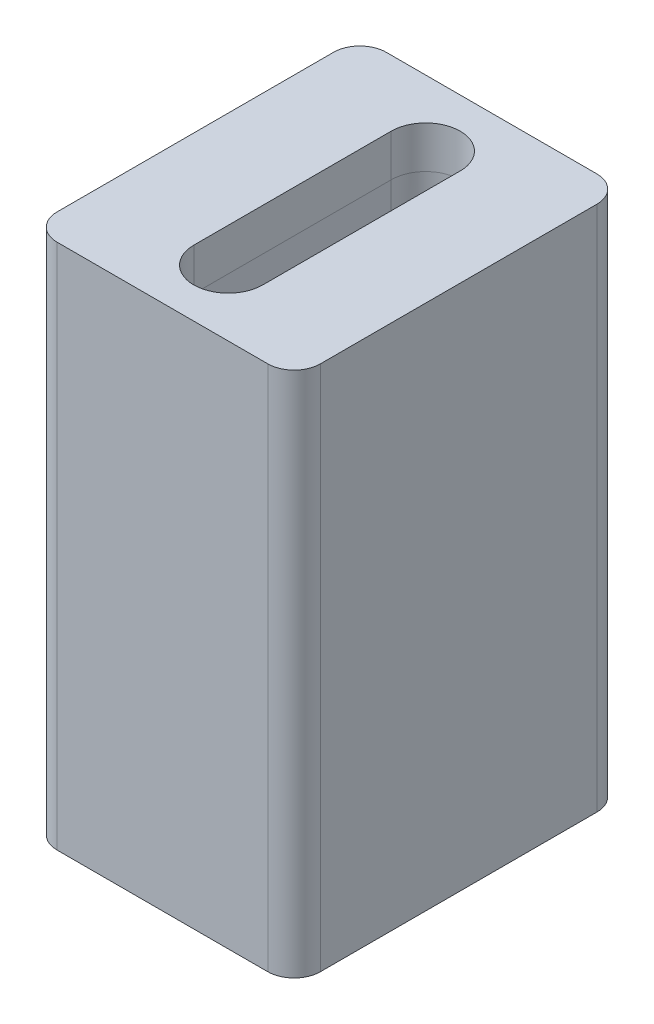
from build123d import *

# Parameters (mm, degrees)
BOSS_EXTRUDE1_DEPTH         = 40
CUT_EXTRUDE2_REACH          = 45.084
M3_TAPPED_HOLE1_D           = 2.5
M3_TAPPED_HOLE1_DEPTH       = 8.5
M3_TAPPED_HOLE1_CSINK_D     = 3.05
M3_TAPPED_HOLE1_CSINK_ANGLE = 90
M3_TAPPED_HOLE1_TIP         = 0.751075774


with BuildPart() as part:
    # Sketch1 → Boss-Extrude1 (new body)
    with BuildSketch(Plane(origin=(0, 0, 0), x_dir=(1, 0, 0), z_dir=(0, 1, 0))):
        with BuildLine():
            Line((-8, -12.5), (8, -12.5))
            ThreePointArc((8, -12.5), (9.414213562, -11.914213562), (10, -10.5))
            Line((10, -10.5), (10, 10.5))
            ThreePointArc((10, 10.5), (9.414213562, 11.914213562), (8, 12.5))
            Line((8, 12.5), (-8, 12.5))
            ThreePointArc((-8, 12.5), (-9.414213562, 11.914213562), (-10, 10.5))
            Line((-10, 10.5), (-10, -10.5))
            ThreePointArc((-10, -10.5), (-9.414213562, -11.914213562), (-8, -12.5))
        make_face()
    extrude(amount=-BOSS_EXTRUDE1_DEPTH)

    # Sketch5 → Cut-Extrude2 (cut, up to next)
    with BuildSketch(Plane(origin=(0, 0, 0), x_dir=(1, 0, 0), z_dir=(0, 1, 0)), mode=Mode.PRIVATE) as cut_extrude2_sk1:
        with BuildLine():
            Line((-2.62, -7.5), (-2.62, 7.5))
            ThreePointArc((-2.62, 7.5), (0, 10.12), (2.62, 7.5))
            Line((2.62, 7.5), (2.62, -7.5))
            ThreePointArc((2.62, -7.5), (0, -10.12), (-2.62, -7.5))
        make_face()
    cut_extrude2_tool1 = extrude(cut_extrude2_sk1.sketch, amount=-CUT_EXTRUDE2_REACH, mode=Mode.PRIVATE) & part.part
    add(cut_extrude2_tool1.solids().sort_by_distance((0, 0, 0))[0], mode=Mode.SUBTRACT)

    # Cut-Sweep1: sweep along a path in Sketch8
    with BuildLine(Plane(origin=(0, 0, 0), x_dir=(1, 0, 0), z_dir=(0, 1, 0))) as cut_sweep1_path:
        Line((-2.62, 7.5), (-2.62, -7.5))
        ThreePointArc((-2.62, -7.5), (0, -10.12), (2.62, -7.5))
        Line((2.62, -7.5), (2.62, 7.5))
        ThreePointArc((2.62, 7.5), (0, 10.12), (-2.62, 7.5))
    # Sketch7 → Cut-Sweep1 (sweep, cut)
    with BuildSketch(Plane.XY):
        Polygon((2.62, -3.2), (3.262346389, -40), (2.62, -40), align=None)
    sweep(path=cut_sweep1_path.line, mode=Mode.SUBTRACT)

    # M3 Tapped Hole1
    with Locations(Plane(origin=(0, -40, 0), x_dir=(-1, 0, 0), z_dir=(0, -1, 0))):
        with Locations((-7, 9.5), (7, -9.5)):
            CounterSinkHole(M3_TAPPED_HOLE1_D / 2, M3_TAPPED_HOLE1_CSINK_D / 2, depth=M3_TAPPED_HOLE1_DEPTH, counter_sink_angle=M3_TAPPED_HOLE1_CSINK_ANGLE)
            with Locations((0, 0, -(M3_TAPPED_HOLE1_DEPTH + M3_TAPPED_HOLE1_TIP / 2))):  # 118° drill point
                Cone(0, M3_TAPPED_HOLE1_D / 2, M3_TAPPED_HOLE1_TIP, mode=Mode.SUBTRACT)


solid = part.part
